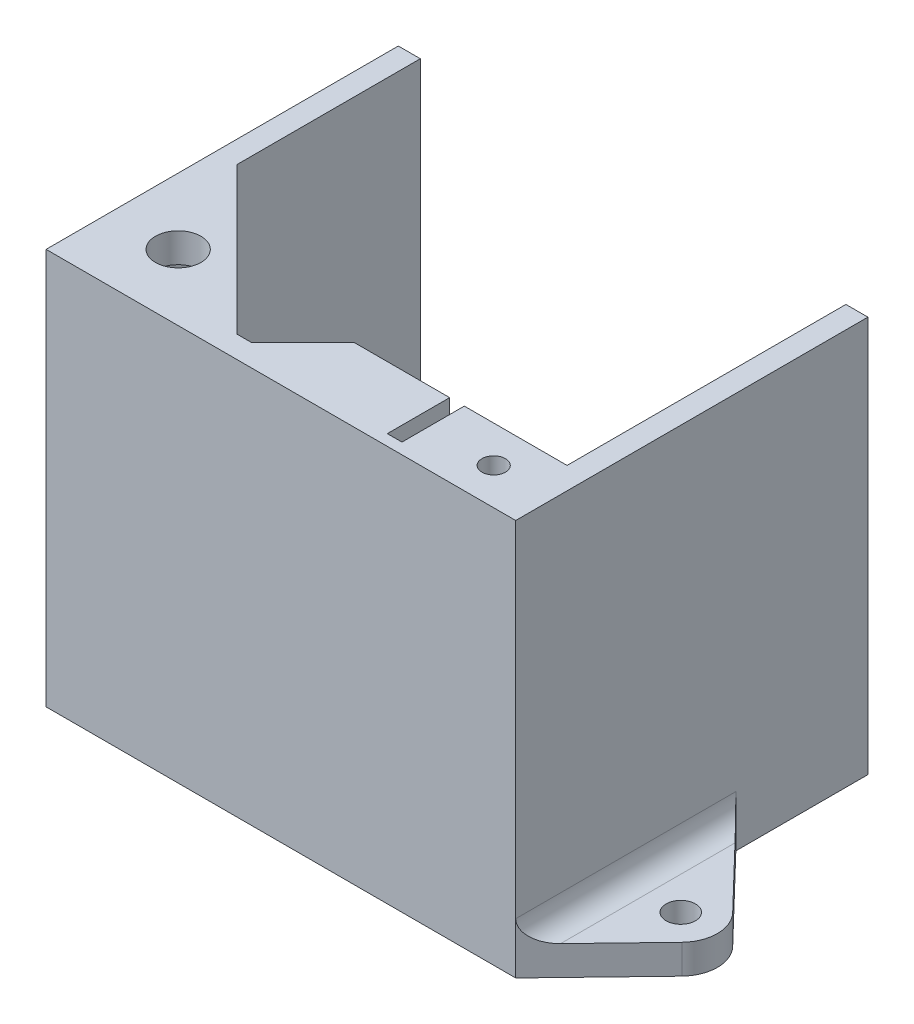
from build123d import *

# Parameters (mm, degrees)
SKETCH1_W           = 64
SKETCH1_H           = 48
BOSS_EXTRUDE1_DEPTH = 4
CUT_EXTRUDE1_DEPTH  = 2.4
CUT_EXTRUDE2_DEPTH  = 2.4
BOSS_EXTRUDE3_DEPTH = 50
BOSS_EXTRUDE4_DEPTH = 50
CUT_EXTRUDE4_DEPTH  = 9.5
SKETCH13_W          = 36.946258726
SKETCH13_H          = 1
CUT_EXTRUDE6_DEPTH  = 32
SKETCH15_R          = 3.1
BOSS_EXTRUDE5_DEPTH = 4
CUT_EXTRUDE7_DEPTH  = 7
SKETCH18_W          = 5.8
SKETCH18_H          = 2.6
CUT_EXTRUDE8_DEPTH  = 5
SKETCH19_R          = 1.6
BOSS_EXTRUDE8_DEPTH = 4.4
FILLET1_R           = 1.5
SKETCH20_R          = 2
BOSS_EXTRUDE9_DEPTH = 4
FILLET2_R           = 3
SKETCH22_R          = 1.65
CUT_EXTRUDE9_DEPTH  = 2


with BuildPart() as part:
    # Sketch1 → Boss-Extrude1 (new body)
    with BuildSketch(Plane(origin=(0, 0, 0), x_dir=(1, 0, 0), z_dir=(0, 1, 0))):
        Rectangle(SKETCH1_W, SKETCH1_H)
    extrude(amount=BOSS_EXTRUDE1_DEPTH)

    # Sketch2 → Cut-Extrude1 (cut)
    with BuildSketch(Plane.XZ):
        Polygon((-20.651368439, -16), (-22.325684219, -13.1), (-25.674315781, -13.1), (-27.348631561, -16), (-25.674315781, -18.9), (-22.325684219, -18.9), align=None)
    extrude(amount=-CUT_EXTRUDE1_DEPTH, mode=Mode.SUBTRACT)

    # Sketch4 → Cut-Extrude2 (cut)
    with BuildSketch(Plane.XZ):
        Polygon((9.348631561, 10), (7.674315781, 12.9), (4.325684219, 12.9), (2.651368439, 10), (4.325684219, 7.1), (7.674315781, 7.1), align=None)
    extrude(amount=-CUT_EXTRUDE2_DEPTH, mode=Mode.SUBTRACT)

    # Sketch6 → Boss-Extrude3 (add)
    with BuildSketch(Plane(origin=(0, 4, 0), x_dir=(1, 0, 0), z_dir=(0, 1, 0))):
        Polygon((-29, -21), (-29, 21), (-29, 24), (-32, 24), (-32, -24), (32, -24), (32, 24), (29, 24), (29, 21), (29, -21), align=None)
    extrude(amount=BOSS_EXTRUDE3_DEPTH)

    # Sketch9 → Boss-Extrude4 (add)
    with BuildSketch(Plane(origin=(0, 4, 0), x_dir=(1, 0, 0), z_dir=(0, 1, 0))):
        Polygon((29, -13), (1, -13), (-7, -21), (29, -21), align=None)
    extrude(amount=BOSS_EXTRUDE4_DEPTH)

    # Sketch10 → Cut-Extrude4 (cut)
    with BuildSketch(Plane(origin=(0, 0, 13), x_dir=(-1, 0, 0), z_dir=(0, 0, -1))):
        Polygon((-14.998616503, 39), (-27, 39), (-27, 13), (-1, 13), (-1, 39), (-13.001383497, 39), (-13.001383497, 54), (-14.998616503, 54), align=None)
    extrude(amount=-CUT_EXTRUDE4_DEPTH, mode=Mode.SUBTRACT)

    # Sketch13 → Cut-Extrude6 (cut)
    with BuildSketch(Plane(origin=(0, 54, 0), x_dir=(1, 0, 0), z_dir=(0, 1, 0))):
        with Locations((10.526870637, -13.5)):
            Rectangle(SKETCH13_W, SKETCH13_H)
    extrude(amount=-CUT_EXTRUDE6_DEPTH, mode=Mode.SUBTRACT)

    # Sketch15 → Boss-Extrude5 (add)
    with BuildSketch(Plane(origin=(0, 54, 0), x_dir=(1, 0, 0), z_dir=(0, 1, 0))):
        Polygon((-29, -1), (-9, -21), (-29, -21), align=None)
        with Locations((-23, -15)):
            Circle(SKETCH15_R, mode=Mode.SUBTRACT)
    extrude(amount=-BOSS_EXTRUDE5_DEPTH)

    # Sketch17 → Cut-Extrude7 (cut)
    with BuildSketch(Plane(origin=(0, 54, 0), x_dir=(1, 0, 0), z_dir=(0, 1, 0))):
        Polygon((24, -15.651368439), (21.1, -17.325684219), (21.1, -20.674315781), (24, -22.348631561), (26.9, -20.674315781), (26.9, -17.325684219), align=None)
    extrude(amount=-CUT_EXTRUDE7_DEPTH, mode=Mode.SUBTRACT)

    # Sketch18 → Cut-Extrude8 (cut)
    with BuildSketch(Plane(origin=(0, 0, 14), x_dir=(-1, 0, 0), z_dir=(0, 0, -1))):
        with Locations((-24, 48.3)):
            Rectangle(SKETCH18_W, SKETCH18_H)
    extrude(amount=-CUT_EXTRUDE8_DEPTH, mode=Mode.SUBTRACT)

    # Sketch19 → Boss-Extrude8 (add)
    with BuildSketch(Plane(origin=(0, 54, 0), x_dir=(1, 0, 0), z_dir=(0, 1, 0))):
        Polygon((26.9, -17.325684219), (24, -15.651368439), (21.1, -17.325684219), (21.1, -20.674315781), (24, -22.348631561), (26.9, -20.674315781), align=None)
        with Locations((24, -19)):
            Circle(SKETCH19_R, mode=Mode.SUBTRACT)
    extrude(amount=-BOSS_EXTRUDE8_DEPTH)

    # Fillet1
    fillet1_edges = [part.edges().sort_by_distance(p)[0] for p in [
        (-29, 50, 11),
        (-19, 50, 21),
    ]]
    fillet(fillet1_edges, radius=FILLET1_R)

    # Sketch20 → Boss-Extrude9 (add)
    # profile 1 of 2: a face of its own
    with BuildSketch(Plane.XZ):
        with BuildLine():
            Line((43.102082828, 12.467708073), (32.000000003, 23.999999995))
            Line((32.000000003, 23.999999995), (32, -6.000000006))
            Line((32, -6.000000006), (43.102082822, 5.532291909))
            ThreePointArc((43.102082822, 5.532291909), (44.500000003, 8.99999999), (43.102082828, 12.467708073))
        make_face()
        with Locations((39.500000002, 8.999999994)):
            Circle(SKETCH20_R, mode=Mode.SUBTRACT)
    # profile 2 of 2: a face of its own
    with BuildSketch(Plane.XZ):
        with BuildLine():
            Line((-32, -24), (-32, 2.000000002))
            Line((-32, 2.000000002), (-42.978939192, -7.408763151))
            ThreePointArc((-42.978939192, -7.408763151), (-44.499999999, -10.999999999), (-42.978939192, -14.591236846))
            Line((-42.978939192, -14.591236846), (-32, -24))
        make_face()
        with Locations((-39.499999999, -10.999999999)):
            Circle(SKETCH20_R, mode=Mode.SUBTRACT)
    extrude(amount=-BOSS_EXTRUDE9_DEPTH)

    # Fillet2
    fillet2_edges = [part.edges().sort_by_distance(p)[0] for p in [
        (-32, 4, -10.999999999),
        (32.000000002, 4, 8.999999995),
    ]]
    fillet(fillet2_edges, radius=FILLET2_R)

    # Sketch22 → Cut-Extrude9 (cut)
    with BuildSketch(Plane.XZ.offset(-2.4)):
        with Locations((-24, -16)):
            Circle(SKETCH22_R)
        with Locations((6, 10)):
            Circle(SKETCH22_R)
    extrude(amount=-CUT_EXTRUDE9_DEPTH, mode=Mode.SUBTRACT)


solid = part.part
